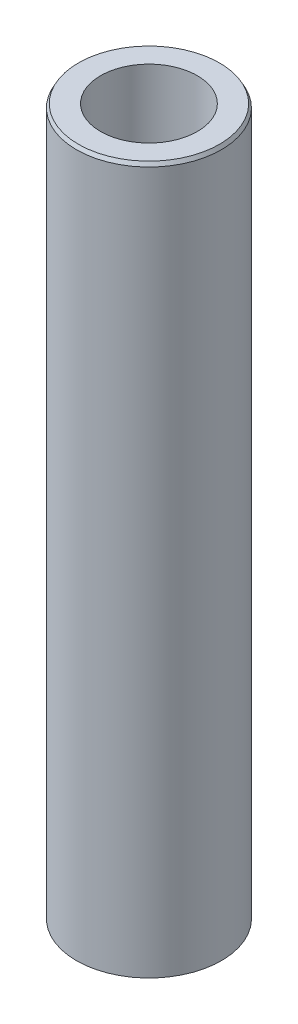
from build123d import *
from OCP.BRepFilletAPI import BRepFilletAPI_MakeChamfer

# Parameters (mm, degrees)
SKETCH1_R           = 57.5
BOSS_EXTRUDE1_DEPTH = 561.435122284
SKETCH2_R           = 38.378256256
CUT_EXTRUDE1_DEPTH  = 568.293483599
CHAMFER1_SIZE       = 2.939484111
CHAMFER1_SIZE2      = 1.569623245


with BuildPart() as part:
    # Sketch1 → Boss-Extrude1 (new body)
    with BuildSketch(Plane(origin=(0, 0, 0), x_dir=(1, 0, 0), z_dir=(0, 1, 0))):
        Circle(SKETCH1_R)
    extrude(amount=BOSS_EXTRUDE1_DEPTH)

    # Sketch2 → Cut-Extrude1 (cut, through all)
    with BuildSketch(Plane(origin=(0, 0, 0), x_dir=(1, 0, 0), z_dir=(0, 1, 0))):
        Circle(SKETCH2_R)
    extrude(amount=CUT_EXTRUDE1_DEPTH, mode=Mode.SUBTRACT)

    # Chamfer1: one chamfer whose edges measure the first distance from different faces: ONE call of the kernel's chamfer builder (chamfer() names one face for all edges)
    chamfer1_edges_1 = [part.edges().sort_by_distance(p)[0] for p in [
        (-57.5, 561.435122284, 0),
    ]]
    chamfer1_side_1 = [part.faces().sort_by_distance(p)[0] for p in [
        (-57.5, 280.717561142, 0),
    ]]
    chamfer1_edges_2 = [part.edges().sort_by_distance(p)[0] for p in [
        (-57.5, 0, 0),
    ]]
    chamfer1_side_2 = [part.faces().sort_by_distance(p)[0] for p in [
        (-55.873654403, 0, 0),
    ]]
    chamfer1 = BRepFilletAPI_MakeChamfer(part.part.solid().wrapped)
    for e in chamfer1_edges_1:
        chamfer1.Add(CHAMFER1_SIZE, CHAMFER1_SIZE2, e.wrapped, chamfer1_side_1[0].wrapped)  # the first distance lies on this face
    for e in chamfer1_edges_2:
        chamfer1.Add(CHAMFER1_SIZE, CHAMFER1_SIZE2, e.wrapped, chamfer1_side_2[0].wrapped)  # the first distance lies on this face
    add(Compound.cast(chamfer1.Shape()), mode=Mode.REPLACE)


solid = part.part
